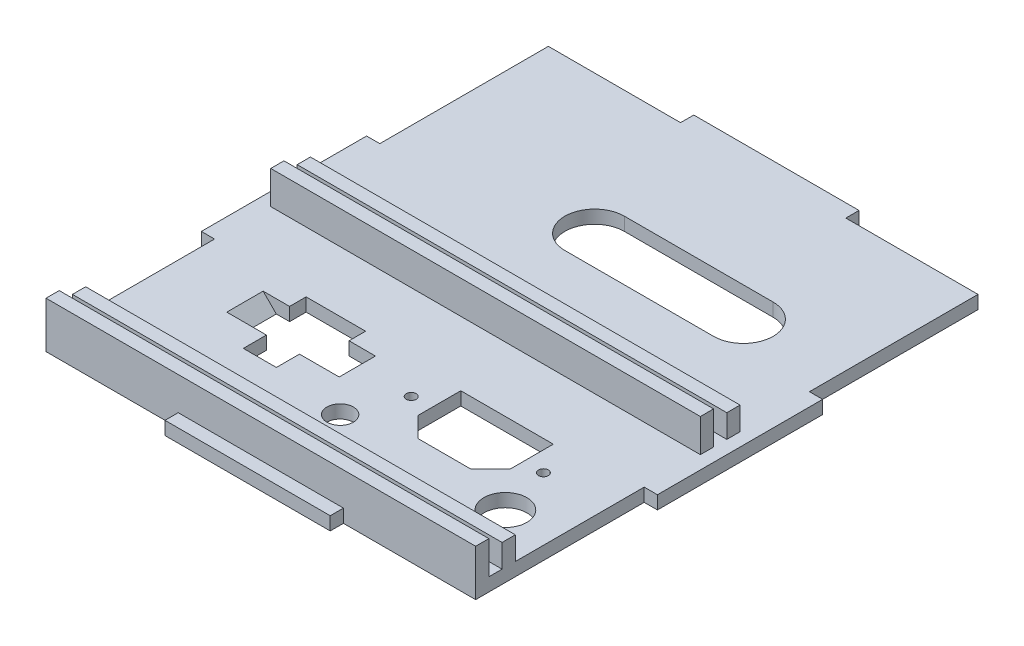
from build123d import *

# Parameters (mm, degrees)
BOSS_EXTRUDE1_DEPTH = 4
SKETCH4_W           = 130
SKETCH4_H           = 4
BOSS_EXTRUDE2_DEPTH = 10
SKETCH5_W           = 130
SKETCH5_H           = 4
BOSS_EXTRUDE3_DEPTH = 7
SKETCH6_W           = 130
SKETCH6_H           = 4
BOSS_EXTRUDE4_DEPTH = 10
SKETCH8_W           = 130
SKETCH8_H           = 4
BOSS_EXTRUDE5_DEPTH = 7
CUT_EXTRUDE1_DEPTH  = 107.117859006
CHAMFER2_SIZE       = 4
CHAMFER3_SIZE       = 4
CUT_EXTRUDE3_DEPTH  = 107.117859006
SKETCH12_R          = 1.5
CUT_EXTRUDE4_DEPTH  = 107.117859006
SKETCH13_R          = 6.5
CUT_EXTRUDE5_DEPTH  = 107.117859006
SKETCH14_R          = 4
CUT_EXTRUDE6_DEPTH  = 107.117859006
CUT_EXTRUDE7_DEPTH  = 10


with BuildPart() as part:
    # Sketch3 → Boss-Extrude1 (new body)
    with BuildSketch(Plane(origin=(0, 0, 0), x_dir=(1, 0, 0), z_dir=(0, 1, 0))):
        Polygon((-25, 80), (25, 80), (25, 76), (65, 76), (65, 25), (69, 25), (69, -25), (65, -25), (65, -76), (25, -76), (25, -80), (-25, -80), (-25, -76), (-65, -76), (-65, -25), (-69, -25), (-69, 25), (-65, 25), (-65, 76), (-25, 76), align=None)
    extrude(amount=BOSS_EXTRUDE1_DEPTH)

    # Sketch4 → Boss-Extrude2 (add)
    with BuildSketch(Plane(origin=(0, 4, 0), x_dir=(1, 0, 0), z_dir=(0, 1, 0))):
        with Locations((0, -74)):
            Rectangle(SKETCH4_W, SKETCH4_H)
    extrude(amount=BOSS_EXTRUDE2_DEPTH)

    # Sketch5 → Boss-Extrude3 (add)
    with BuildSketch(Plane(origin=(0, 4, 0), x_dir=(1, 0, 0), z_dir=(0, 1, 0))):
        with Locations((0, -66)):
            Rectangle(SKETCH5_W, SKETCH5_H)
    extrude(amount=BOSS_EXTRUDE3_DEPTH)

    # Sketch6 → Boss-Extrude4 (add)
    with BuildSketch(Plane(origin=(0, 4, 0), x_dir=(1, 0, 0), z_dir=(0, 1, 0))):
        with Locations((0, -6)):
            Rectangle(SKETCH6_W, SKETCH6_H)
    extrude(amount=BOSS_EXTRUDE4_DEPTH)

    # Sketch8 → Boss-Extrude5 (add)
    with BuildSketch(Plane(origin=(0, 4, 0), x_dir=(1, 0, 0), z_dir=(0, 1, 0))):
        with Locations((0, 2)):
            Rectangle(SKETCH8_W, SKETCH8_H)
    extrude(amount=BOSS_EXTRUDE5_DEPTH)

    # Sketch9 → Cut-Extrude1 (cut, through all)
    with BuildSketch(Plane(origin=(0, 4, 0), x_dir=(1, 0, 0), z_dir=(0, 1, 0))):
        Polygon((-21.999983798, -49.3), (-31.999983798, -49.3), (-31.999983798, -42.3), (-40, -42.3), (-40, -31.3), (-35.999983798, -31.3), (-35.999983798, -26.3), (-17.999983798, -26.3), (-17.999983798, -31.3), (-14, -31.311384755), (-14, -42.288615245), (-22, -42.3), align=None)
    extrude(amount=-CUT_EXTRUDE1_DEPTH, mode=Mode.SUBTRACT)

    # Chamfer2
    chamfer2_edges = [part.edges().sort_by_distance(p)[0] for p in [
        (-40, 4, 36.8),
    ]]
    chamfer(chamfer2_edges, length=CHAMFER2_SIZE - 0.0001)  # a hair under: the kernel refuses the full size

    # Chamfer3
    chamfer3_edges = [part.edges().sort_by_distance(p)[0] for p in [
        (-14, 4, 36.8),
    ]]
    chamfer(chamfer3_edges, length=CHAMFER3_SIZE - 0.0001)  # a hair under: the kernel refuses the full size

    # Sketch11 → Cut-Extrude3 (cut, through all)
    with BuildSketch(Plane(origin=(0, 4, 0), x_dir=(1, 0, 0), z_dir=(0, 1, 0))):
        Polygon((12, -27.5), (40, -27.5), (40, -40.5), (34, -46.5), (18, -46.5), (12, -40.5), align=None)
    extrude(amount=-CUT_EXTRUDE3_DEPTH, mode=Mode.SUBTRACT)

    # Sketch12 → Cut-Extrude4 (cut, through all)
    with BuildSketch(Plane(origin=(0, 4, 0), x_dir=(1, 0, 0), z_dir=(0, 1, 0))):
        with Locations(Location((6, -36.5, 0), (0, 0, 270))):
            Circle(SKETCH12_R)
        with Locations(Location((46, -36.5, 0), (0, 0, 270))):
            Circle(SKETCH12_R)
    extrude(amount=-CUT_EXTRUDE4_DEPTH, mode=Mode.SUBTRACT)

    # Sketch13 → Cut-Extrude5 (cut, through all)
    with BuildSketch(Plane(origin=(0, 4, 0), x_dir=(1, 0, 0), z_dir=(0, 1, 0))):
        with Locations(Location((50, -52, 0), (0, 0, 270))):
            Circle(SKETCH13_R)
    extrude(amount=-CUT_EXTRUDE5_DEPTH, mode=Mode.SUBTRACT)

    # Sketch14 → Cut-Extrude6 (cut, through all)
    with BuildSketch(Plane(origin=(0, 4, 0), x_dir=(1, 0, 0), z_dir=(0, 1, 0))):
        with Locations(Location((0, -52, 0), (0, 0, 270))):
            Circle(SKETCH14_R)
    extrude(amount=-CUT_EXTRUDE6_DEPTH, mode=Mode.SUBTRACT)

    # Sketch15 → Cut-Extrude7 (cut)
    with BuildSketch(Plane.XZ):
        with BuildLine():
            Line((-9, -25), (36, -25))
            ThreePointArc((36, -25), (45, -34), (36, -43))
            Line((36, -43), (-9, -43))
            ThreePointArc((-9, -43), (-18, -34), (-9, -25))
        make_face()
    extrude(amount=-CUT_EXTRUDE7_DEPTH, mode=Mode.SUBTRACT)


solid = part.part
